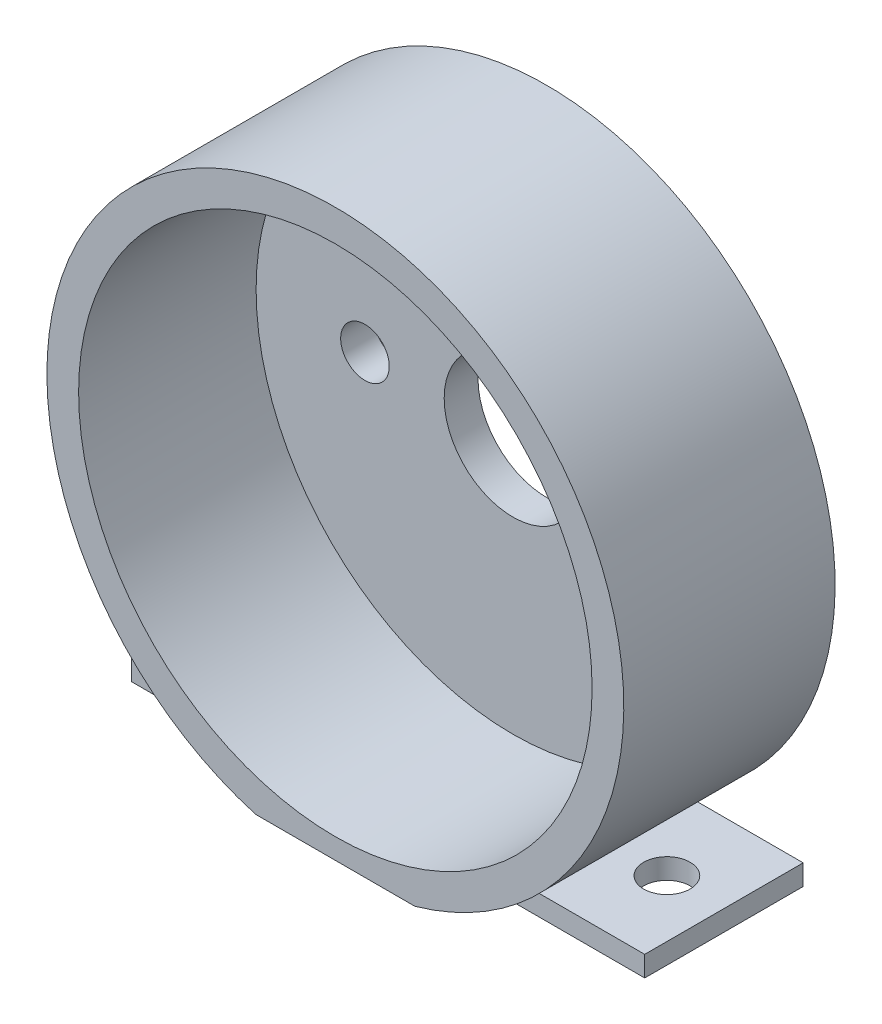
from build123d import *

# Parameters (mm, degrees)
SKETCH1_R           = 13.65
SKETCH1_R_2         = 12.15
BOSS_EXTRUDE1_DEPTH = 10
BOSS_EXTRUDE3_DEPTH = 7.5
SKETCH5_R           = 1.1
CUT_EXTRUDE1_DEPTH  = 1.5
SKETCH6_W           = 24.28
SKETCH6_H           = 0.53
CUT_EXTRUDE2_DEPTH  = 22.74040018
SKETCH7_R           = 12.15
SKETCH7_R_2         = 1.15
SKETCH7_R_3         = 3.25
BOSS_EXTRUDE4_DEPTH = 1.6


with BuildPart() as part:
    # Sketch1 → Boss-Extrude1 (new body)
    with BuildSketch(Plane.XY):
        Circle(SKETCH1_R)
        Circle(SKETCH1_R_2, mode=Mode.SUBTRACT)
    extrude(amount=BOSS_EXTRUDE1_DEPTH)

    # Sketch3 → Boss-Extrude3 (add)
    with BuildSketch(Plane(origin=(0, 0, 0), x_dir=(-1, 0, 0), z_dir=(0, 0, -1))):
        with BuildLine():
            ThreePointArc((2e-09, -13.65), (-3.19960935, -13.269702333), (-6.220932406, -12.15))
            Line((-6.220932406, -12.15), (-12.14, -12.15))
            Line((-12.14, -12.15), (-12.14, -13.65))
            Line((-12.14, -13.65), (2e-09, -13.65))
        make_face()
        with BuildLine():
            ThreePointArc((6.220932406, -12.15), (3.199609352, -13.269702333), (2e-09, -13.65))
            Line((2e-09, -13.65), (12.14, -13.65))
            Line((12.14, -13.65), (12.14, -12.15))
            Line((12.14, -12.15), (6.220932406, -12.15))
        make_face()
    extrude(amount=-BOSS_EXTRUDE3_DEPTH)

    # Sketch5 → Cut-Extrude1 (cut)
    with BuildSketch(Plane.XZ.offset(13.65)):
        with Locations((-9.44, 3.75)):
            Circle(SKETCH5_R)
        with Locations((9.44, 3.75)):
            Circle(SKETCH5_R)
    extrude(amount=-CUT_EXTRUDE1_DEPTH, mode=Mode.SUBTRACT)

    # Sketch6 → Cut-Extrude2 (cut, through all)
    with BuildSketch(Plane(origin=(0, 0, 0), x_dir=(-1, 0, 0), z_dir=(0, 0, -1))):
        with Locations((0, -13.385)):
            Rectangle(SKETCH6_W, SKETCH6_H)
    extrude(amount=-CUT_EXTRUDE2_DEPTH, mode=Mode.SUBTRACT)

    # Sketch7 → Boss-Extrude4 (add)
    with BuildSketch(Plane(origin=(0, 0, 0), x_dir=(-1, 0, 0), z_dir=(0, 0, -1))):
        Circle(SKETCH7_R)
        with Locations((-7, 0)):
            Circle(SKETCH7_R_2, mode=Mode.SUBTRACT)
        with Locations((7, 0)):
            Circle(SKETCH7_R_2, mode=Mode.SUBTRACT)
        Circle(SKETCH7_R_3, mode=Mode.SUBTRACT)
    extrude(amount=-BOSS_EXTRUDE4_DEPTH)


solid = part.part
